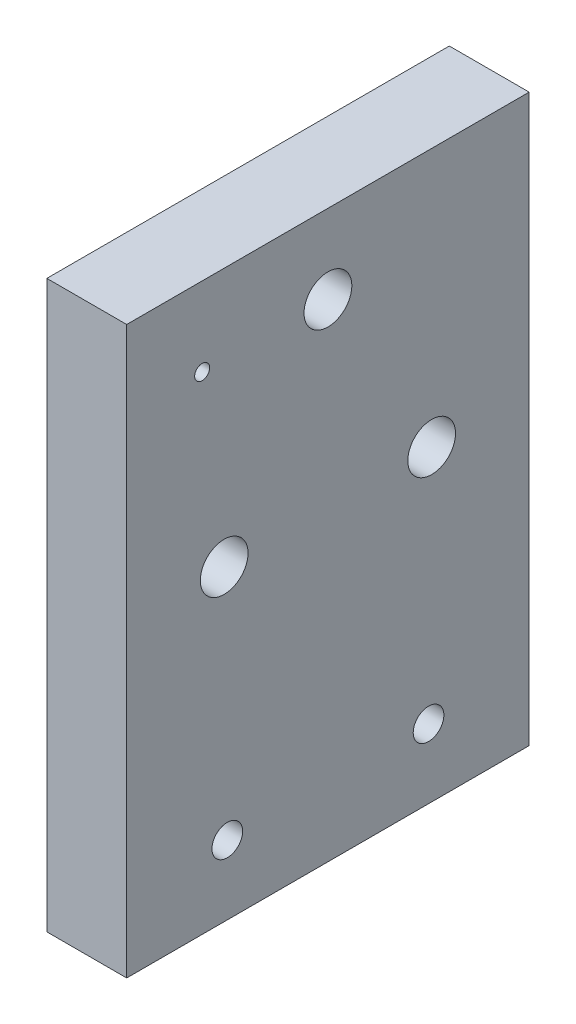
from build123d import *

# Parameters (mm, degrees)
SKETCH26_W                                          = 6.35
SKETCH26_H                                          = 32
BOSS_EXTRUDE2_DEPTH                                 = 45
CUT_EXTRUDE7_REACH                                  = 57.582
SKETCH27_R                                          = 1.595
CBORE_FOR_6_BINDING_HEAD_MACHINE_SCREW1_D           = 3.7973
CBORE_FOR_6_BINDING_HEAD_MACHINE_SCREW1_DEPTH       = 46.5
CBORE_FOR_6_BINDING_HEAD_MACHINE_SCREW1_CBORE_D     = 9.525
CBORE_FOR_6_BINDING_HEAD_MACHINE_SCREW1_CBORE_DEPTH = 1.016
CBORE_FOR_6_BINDING_HEAD_MACHINE_SCREW1_TIP         = 1.140824014
F_0_80_TAPPED_HOLE1_D                               = 1.19126
F_2_CLEARANCE_HOLE1_D                               = 2.4384
F_2_CLEARANCE_HOLE1_DEPTH                           = 20.32
F_2_CLEARANCE_HOLE1_TIP                             = 0.732569267


with BuildPart() as part:
    # Sketch26 → Boss-Extrude2 (new body)
    with BuildSketch(Plane(origin=(0, 0, 0), x_dir=(-1, 0, 0), z_dir=(0, 1, 0))):
        with Locations((-3.175, 16)):
            Rectangle(SKETCH26_W, SKETCH26_H)
    extrude(amount=BOSS_EXTRUDE2_DEPTH)

    # Sketch27 → Cut-Extrude7 (cut, up to next)
    with BuildSketch(Plane.ZY, mode=Mode.PRIVATE) as cut_extrude7_sk1:
        with Locations((16, 38.725)):
            Circle(SKETCH27_R)
    cut_extrude7_tool1 = extrude(cut_extrude7_sk1.sketch, amount=-CUT_EXTRUDE7_REACH, mode=Mode.PRIVATE) & part.part
    # Sketch27 → Cut-Extrude7 (cut, up to next)
    with BuildSketch(Plane.ZY, mode=Mode.PRIVATE) as cut_extrude7_sk2:
        with Locations((24.248891971, 24.4375)):
            Circle(SKETCH27_R)
    cut_extrude7_tool2 = extrude(cut_extrude7_sk2.sketch, amount=-CUT_EXTRUDE7_REACH, mode=Mode.PRIVATE) & part.part
    # Sketch27 → Cut-Extrude7 (cut, up to next)
    with BuildSketch(Plane.ZY, mode=Mode.PRIVATE) as cut_extrude7_sk3:
        with Locations((7.751108029, 24.4375)):
            Circle(SKETCH27_R)
    cut_extrude7_tool3 = extrude(cut_extrude7_sk3.sketch, amount=-CUT_EXTRUDE7_REACH, mode=Mode.PRIVATE) & part.part
    add(cut_extrude7_tool1.solids().sort_by_distance((0, 38.725, 16))[0], mode=Mode.SUBTRACT)
    add(cut_extrude7_tool2.solids().sort_by_distance((0, 24.4375, 24.248892))[0], mode=Mode.SUBTRACT)
    add(cut_extrude7_tool3.solids().sort_by_distance((0, 24.4375, 7.751108))[0], mode=Mode.SUBTRACT)

    # CBORE for #6 Binding Head Machine Screw1
    with Locations(Plane.ZY):
        with Locations((16, 38.725), (24.248891971, 24.4375), (7.751108029, 24.4375)):
            CounterBoreHole(CBORE_FOR_6_BINDING_HEAD_MACHINE_SCREW1_D / 2, CBORE_FOR_6_BINDING_HEAD_MACHINE_SCREW1_CBORE_D / 2, CBORE_FOR_6_BINDING_HEAD_MACHINE_SCREW1_CBORE_DEPTH, depth=CBORE_FOR_6_BINDING_HEAD_MACHINE_SCREW1_DEPTH)
            with Locations((0, 0, -(CBORE_FOR_6_BINDING_HEAD_MACHINE_SCREW1_DEPTH + CBORE_FOR_6_BINDING_HEAD_MACHINE_SCREW1_TIP / 2))):  # 118° drill point
                Cone(0, CBORE_FOR_6_BINDING_HEAD_MACHINE_SCREW1_D / 2, CBORE_FOR_6_BINDING_HEAD_MACHINE_SCREW1_TIP, mode=Mode.SUBTRACT)

    # #0-80 Tapped Hole1 (through all)
    with Locations(Plane.ZY):
        with Locations((26, 38.725)):
            Hole(F_0_80_TAPPED_HOLE1_D / 2)

    # #2 Clearance Hole1
    with Locations(Plane.ZY):
        with Locations((8, 5.5), (24, 5.5)):
            Hole(F_2_CLEARANCE_HOLE1_D / 2, depth=F_2_CLEARANCE_HOLE1_DEPTH)
            with Locations((0, 0, -(F_2_CLEARANCE_HOLE1_DEPTH + F_2_CLEARANCE_HOLE1_TIP / 2))):  # 118° drill point
                Cone(0, F_2_CLEARANCE_HOLE1_D / 2, F_2_CLEARANCE_HOLE1_TIP, mode=Mode.SUBTRACT)


solid = part.part
